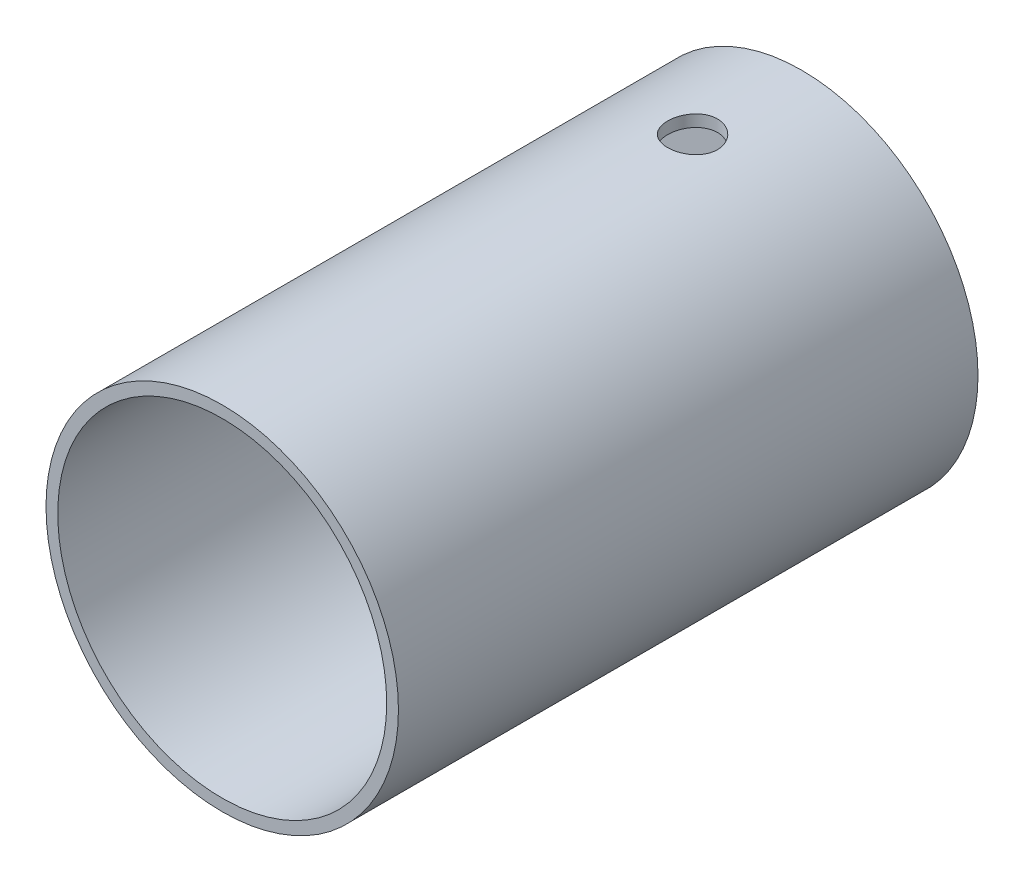
from build123d import *

# Parameters (mm, degrees)
ESQUISSE1_R                 = 22.5
BOSS_EXTRU_1_DEPTH          = 4
ESQUISSE2_R                 = 22.5
ESQUISSE2_R_2               = 21
BOSS_EXTRU_2_DEPTH          = 70
ENL_V_START                 = 20.75783225
ENL_V_MAT_EXTRU_1_OUTLINE_R = 3.18
ENL_V_MAT_EXTRU_1_DEPTH     = 1.742167853


# Read off the part's stored shape, not the designer's step: Enlèv. mat.-Extru.1
with BuildPart() as part:
    # Esquisse1 → Boss.-Extru.1 (new body)
    with BuildSketch(Plane.XY):
        Circle(ESQUISSE1_R)
    extrude(amount=BOSS_EXTRU_1_DEPTH)

    # Esquisse2 → Boss.-Extru.2 (add)
    with BuildSketch(Plane.XY.offset(4)):
        Circle(ESQUISSE2_R)
        Circle(ESQUISSE2_R_2, mode=Mode.SUBTRACT)
    extrude(amount=BOSS_EXTRU_2_DEPTH)

    # Enlèv. mat.-Extru.1 outline → Enlèv. mat.-Extru.1 (cut)
    with BuildSketch(Plane(origin=(0, 0, 0), x_dir=(1, 0, 0), z_dir=(0, 1, 0)).offset(ENL_V_START)):
        with Locations((0, -13.943817021)):
            Circle(ENL_V_MAT_EXTRU_1_OUTLINE_R)
    extrude(amount=ENL_V_MAT_EXTRU_1_DEPTH, mode=Mode.SUBTRACT)


solid = part.part
